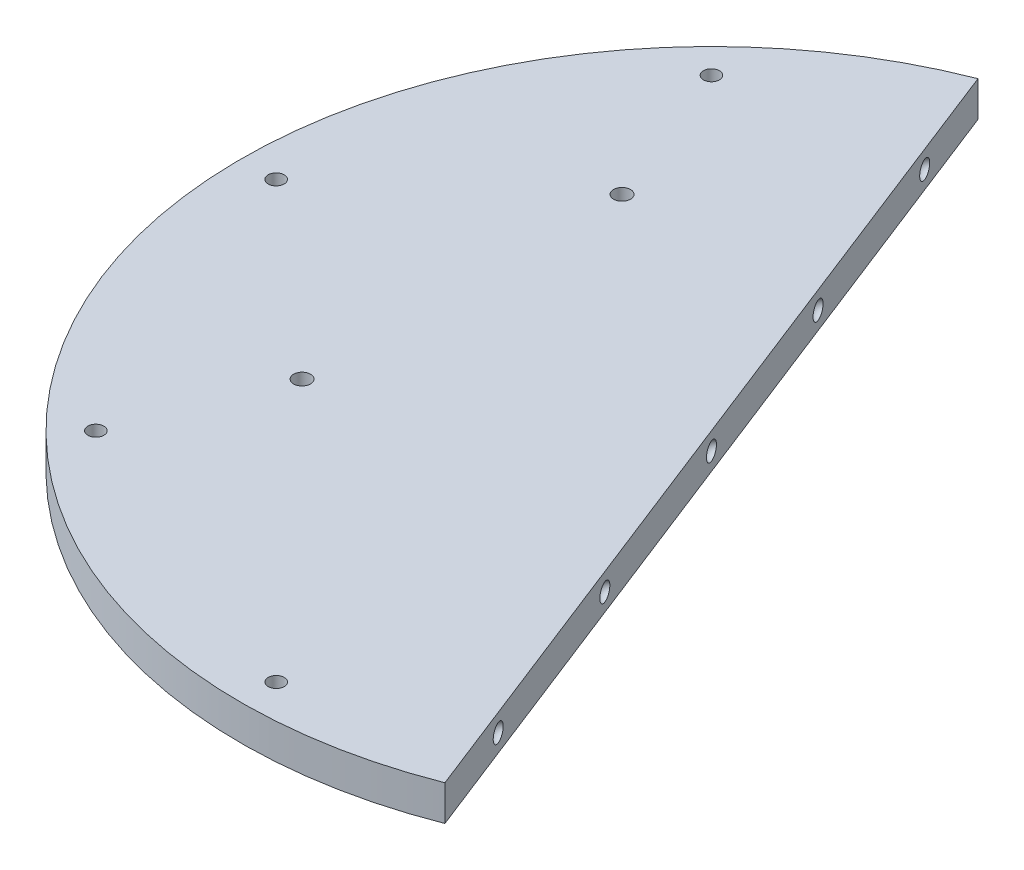
from build123d import *

# Parameters (mm, degrees)
SKETCH1_R                      = 100
BOSS_EXTRUDE1_DEPTH            = 7.5
CBORE_FOR_M3_SHCS1_D           = 3.4
CBORE_FOR_M3_SHCS1_DEPTH       = 7.5
CBORE_FOR_M3_SHCS1_CBORE_D     = 6.5
CBORE_FOR_M3_SHCS1_CBORE_DEPTH = 3
CBORE_FOR_M3_SHCS1_TIP         = 1.021463052
CBORE_FOR_M3_SHCS2_D           = 3.6
CBORE_FOR_M3_SHCS2_DEPTH       = 7.5
CBORE_FOR_M3_SHCS2_CBORE_D     = 6.5
CBORE_FOR_M3_SHCS2_CBORE_DEPTH = 3
CBORE_FOR_M3_SHCS2_TIP         = 1.081549114
SKETCH9_W                      = 276.839915284
SKETCH9_H                      = 86.454597136
CUT_EXTRUDE1_DEPTH             = 142.620090383
SKETCH10_R                     = 1.875
CUT_EXTRUDE2_DEPTH             = 1.875
FILLET1_R                      = 1.875


with BuildPart() as part:
    # Sketch1 → Boss-Extrude1 (new body)
    with BuildSketch(Plane(origin=(0, 0, 0), x_dir=(1, 0, 0), z_dir=(0, 1, 0))):
        with Locations(Location((0, 0, 0), (0, 0, 270))):
            Circle(SKETCH1_R)
    extrude(amount=BOSS_EXTRUDE1_DEPTH)

    # CBORE for M3 SHCS1
    with Locations(Plane(origin=(0, 0, 0), x_dir=(-1, 0, 0), z_dir=(0, -1, 0))):
        with Locations((0, -92.5), (-65.40737726, -65.40737726), (-92.5, 0), (-65.40737726, 65.40737726), (0, 92.5), (65.40737726, 65.40737726), (92.5, 0), (65.40737726, -65.40737726)):
            CounterBoreHole(CBORE_FOR_M3_SHCS1_D / 2, CBORE_FOR_M3_SHCS1_CBORE_D / 2, CBORE_FOR_M3_SHCS1_CBORE_DEPTH, depth=CBORE_FOR_M3_SHCS1_DEPTH)
            with Locations((0, 0, -(CBORE_FOR_M3_SHCS1_DEPTH + CBORE_FOR_M3_SHCS1_TIP / 2))):  # 118° drill point
                Cone(0, CBORE_FOR_M3_SHCS1_D / 2, CBORE_FOR_M3_SHCS1_TIP, mode=Mode.SUBTRACT)

    # CBORE for M3 SHCS2
    with Locations(Plane(origin=(0, 0, 0), x_dir=(-1, 0, 0), z_dir=(0, -1, 0))):
        with Locations((-53, 34), (53, 34), (53, -34), (-53, -34)):
            CounterBoreHole(CBORE_FOR_M3_SHCS2_D / 2, CBORE_FOR_M3_SHCS2_CBORE_D / 2, CBORE_FOR_M3_SHCS2_CBORE_DEPTH, depth=CBORE_FOR_M3_SHCS2_DEPTH)
            with Locations((0, 0, -(CBORE_FOR_M3_SHCS2_DEPTH + CBORE_FOR_M3_SHCS2_TIP / 2))):  # 118° drill point
                Cone(0, CBORE_FOR_M3_SHCS2_D / 2, CBORE_FOR_M3_SHCS2_TIP, mode=Mode.SUBTRACT)

    # Sketch9 → Cut-Extrude1 (cut, through all)
    with BuildSketch(Plane(origin=(0, 0, 0), x_dir=(0.3646980843717534, 0, 0.9311258278318637), z_dir=(-0.9311258278318637, 0, 0.3646980843717534))):
        with Locations((-1.022117504, -7.168579764)):
            Rectangle(SKETCH9_W, SKETCH9_H)
    extrude(amount=-CUT_EXTRUDE1_DEPTH, mode=Mode.SUBTRACT)

    # Sketch10 → Cut-Extrude2 (cut)
    with BuildSketch(Plane(origin=(0, 0, 0), x_dir=(0.3646980843717534, 0, 0.9311258278318637), z_dir=(-0.9311258278318637, 0, 0.3646980843717534))):
        with Locations(Location((0, 3.75, 0), (0, 0, 180))):
            Circle(SKETCH10_R)
        with Locations(Location((-40, 3.75, 0), (0, 0, 180))):
            Circle(SKETCH10_R)
        with Locations(Location((-80, 3.75, 0), (0, 0, 180))):
            Circle(SKETCH10_R)
        with Locations(Location((80, 3.75, 0), (0, 0, 180))):
            Circle(SKETCH10_R)
        with Locations(Location((40, 3.75, 0), (0, 0, 180))):
            Circle(SKETCH10_R)
    extrude(amount=CUT_EXTRUDE2_DEPTH, mode=Mode.SUBTRACT)

    # Fillet1
    fillet1_edges = [part.edges().sort_by_distance(p)[0] for p in [
        (-1.062052019, 3.75, 2.429669835),
        (-15.649975394, 3.75, -34.815363278),
        (-30.237898769, 3.75, -72.060396391),
        (28.113794731, 3.75, 76.919736062),
        (13.525871356, 3.75, 39.674702949),
    ]]
    fillet(fillet1_edges, radius=FILLET1_R - 0.0001)  # a hair under: the kernel refuses the full size


solid = part.part
